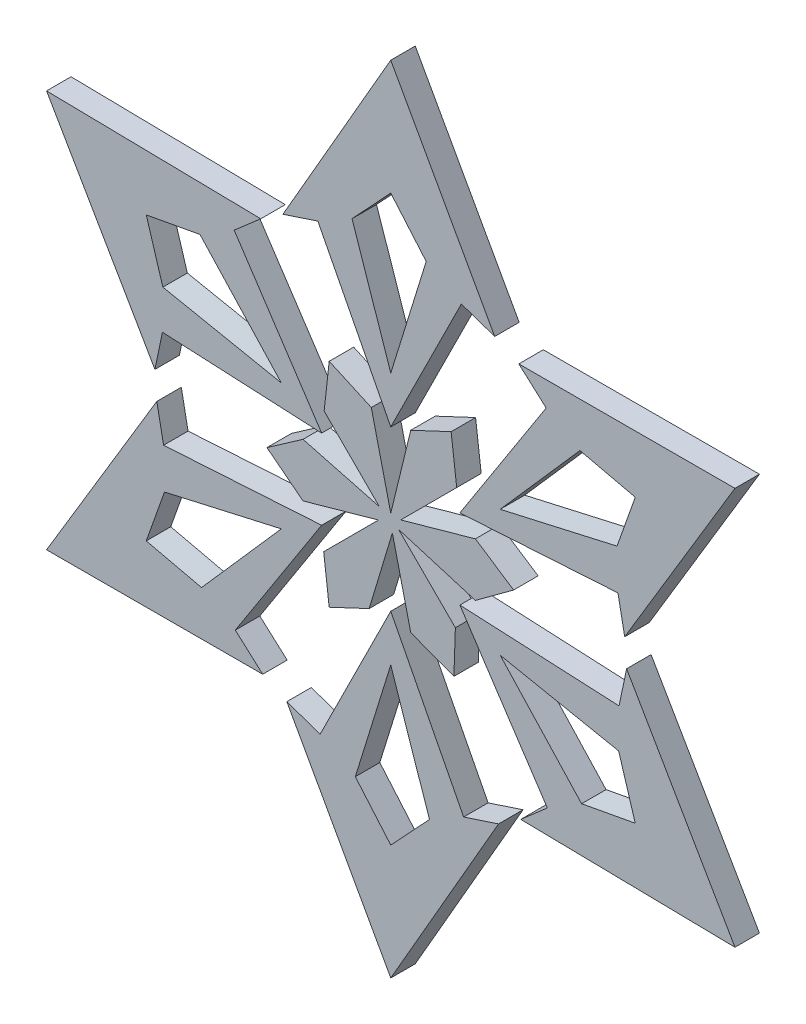
from build123d import *

# Parameters (mm, degrees)
SKETCH_2_W          = 60
SKETCH_2_H          = 60
EXTRUDE_1_DEPTH     = 1.5
SKETCH_3_OUTSIDE_W  = 78.974
SKETCH_3_OUTSIDE_H  = 78.974
CUT_EXTRUDE_1_DEPTH = 1.5


with BuildPart() as part:
    # Эскиз2 → Бобышка-Вытянуть1 (new body)
    with BuildSketch(Plane.XY):
        Rectangle(SKETCH_2_W, SKETCH_2_H)
    extrude(amount=EXTRUDE_1_DEPTH)

    # Эскиз3 outside → Вырез-Вытянуть1 (cut)
    # profile 1 of 7: a face of its own
    with BuildSketch(Plane(origin=(0, 0, 0), x_dir=(-1, 0, 0), z_dir=(0, 0, -1))):
        Rectangle(SKETCH_3_OUTSIDE_W, SKETCH_3_OUTSIDE_H)
        Polygon((0.701245914, 0.310477847), (4.079260937, 3.688492871), (3.770517629, 6.48534402), (1.191602933, 5.323016269), (0, 0.310477847), (-1.223859423, 5.323016269), (-3.697787941, 6.48534402), (-4.038871942, 3.688492871), (-0.611929711, 0.26155064), (-5.183676965, 1.542764596), (-7.525855192, 0), (-5.183676965, -1.723595715), (-0.479243208, -0.30700877), (-3.957145772, -3.784911335), (-3.868329942, -6.409229458), (-1.223859423, -5.410354048), (-0.100666434, -0.685585543), (1.322043658, -5.410354048), (3.770517629, -6.560722468), (4.10903574, -3.784911335), (0.752735701, -0.428611296), (5.373620008, -1.723595715), (7.584405559, 0), (5.373620008, 1.542764596), align=None, mode=Mode.SUBTRACT)
        Polygon((0, 4.888276675), (-4.323822009, 13.569865554), (-6.366298856, 12.867764138), (0, 24.342067355), (6.602384218, 12.867764138), (4.46398048, 13.569865554), align=None, mode=Mode.SUBTRACT)
        Polygon((4.233371781, 2.444138338), (9.589937291, 10.529472478), (7.960661205, 11.947258606), (21.08084871, 12.171033678), (14.445002742, 0.716049611), (13.983838536, 2.919012279), align=None, mode=Mode.SUBTRACT)
        Polygon((4.233371781, -2.444138338), (13.9137593, -3.040393076), (14.326960061, -0.920505531), (21.08084871, -12.171033678), (7.842618524, -12.151714527), (9.519858056, -10.650853275), align=None, mode=Mode.SUBTRACT)
        Polygon((0, -4.888276675), (4.323822009, -13.569865554), (6.366298856, -12.867764138), (0, -24.342067355), (-6.602384218, -12.867764138), (-4.46398048, -13.569865554), align=None, mode=Mode.SUBTRACT)
        Polygon((-4.233371781, -2.444138338), (-9.589937291, -10.529472478), (-7.960661205, -11.947258606), (-21.08084871, -12.171033678), (-14.445002742, -0.716049611), (-13.983838536, -2.919012279), align=None, mode=Mode.SUBTRACT)
        Polygon((-4.233371781, 2.444138338), (-13.9137593, 3.040393076), (-14.326960061, 0.920505531), (-21.08084871, 12.171033678), (-7.842618524, 12.151714527), (-9.519858056, 10.650853275), align=None, mode=Mode.SUBTRACT)
    # profile 2 of 7: a face of its own
    with BuildSketch(Plane(origin=(0, 0, 0), x_dir=(-1, 0, 0), z_dir=(0, 0, -1))):
        Polygon((-2.170973741, 14.749599561), (0, 17.291490997), (2.370336481, 14.749599561), (0, 7.74029622), align=None)
    # profile 3 of 7: a face of its own
    with BuildSketch(Plane(origin=(0, 0, 0), x_dir=(-1, 0, 0), z_dir=(0, 0, -1))):
        Polygon((11.688041045, 9.254918191), (14.974870473, 8.645745499), (13.958696156, 5.322028172), (6.703293159, 3.87014811), align=None)
    # profile 4 of 7: a face of its own
    with BuildSketch(Plane(origin=(0, 0, 0), x_dir=(-1, 0, 0), z_dir=(0, 0, -1))):
        Polygon((13.859014785, -5.49468137), (14.974870473, -8.645745499), (11.588359675, -9.427571388), (6.703293159, -3.87014811), align=None)
    # profile 5 of 7: a face of its own
    with BuildSketch(Plane(origin=(0, 0, 0), x_dir=(-1, 0, 0), z_dir=(0, 0, -1))):
        Polygon((2.170973741, -14.749599561), (0, -17.291490997), (-2.370336481, -14.749599561), (0, -7.74029622), align=None)
    # profile 6 of 7: a face of its own
    with BuildSketch(Plane(origin=(0, 0, 0), x_dir=(-1, 0, 0), z_dir=(0, 0, -1))):
        Polygon((-11.688041045, -9.254918191), (-14.974870473, -8.645745499), (-13.958696156, -5.322028172), (-6.703293159, -3.87014811), align=None)
    # profile 7 of 7: a face of its own
    with BuildSketch(Plane(origin=(0, 0, 0), x_dir=(-1, 0, 0), z_dir=(0, 0, -1))):
        Polygon((-13.859014785, 5.49468137), (-14.974870473, 8.645745499), (-11.588359675, 9.427571388), (-6.703293159, 3.87014811), align=None)
    extrude(amount=-CUT_EXTRUDE_1_DEPTH, mode=Mode.SUBTRACT)


with BuildPart() as cut_extrude_1_piece_1:
    # of the separate pieces the step leaves, piece 1, a body of its own (cut_extrude_1_pieces)
    add(part.part.solids().sort_by_distance((0, -4.888276675, 0))[0])


with BuildPart() as cut_extrude_1_piece_2:
    # of the separate pieces the step leaves, piece 2, a body of its own (cut_extrude_1_pieces)
    add(part.part.solids().sort_by_distance((-4.233371781, -2.444138338, 0))[0])


with BuildPart() as cut_extrude_1_piece_3:
    # of the separate pieces the step leaves, piece 3, a body of its own (cut_extrude_1_pieces)
    add(part.part.solids().sort_by_distance((4.233371781, -2.444138338, 0))[0])


with BuildPart() as cut_extrude_1_piece_4:
    # of the separate pieces the step leaves, piece 4, a body of its own (cut_extrude_1_pieces)
    add(part.part.solids().sort_by_distance((-4.233371781, 2.444138338, 0))[0])


with BuildPart() as cut_extrude_1_piece_5:
    # of the separate pieces the step leaves, piece 5, a body of its own (cut_extrude_1_pieces)
    add(part.part.solids().sort_by_distance((4.233371781, 2.444138338, 0))[0])


with BuildPart() as cut_extrude_1_piece_6:
    # of the separate pieces the step leaves, piece 6, a body of its own (cut_extrude_1_pieces)
    add(part.part.solids().sort_by_distance((0, 4.888276675, 0))[0])


with BuildPart() as cut_extrude_1_piece_7:
    # of the separate pieces the step leaves, piece 7, a body of its own (cut_extrude_1_pieces)
    add(part.part.solids().sort_by_distance((-7.584405559, 0, 0))[0])


solid = Compound([cut_extrude_1_piece_1.part, cut_extrude_1_piece_2.part, cut_extrude_1_piece_3.part, cut_extrude_1_piece_4.part, cut_extrude_1_piece_5.part, cut_extrude_1_piece_6.part, cut_extrude_1_piece_7.part])
